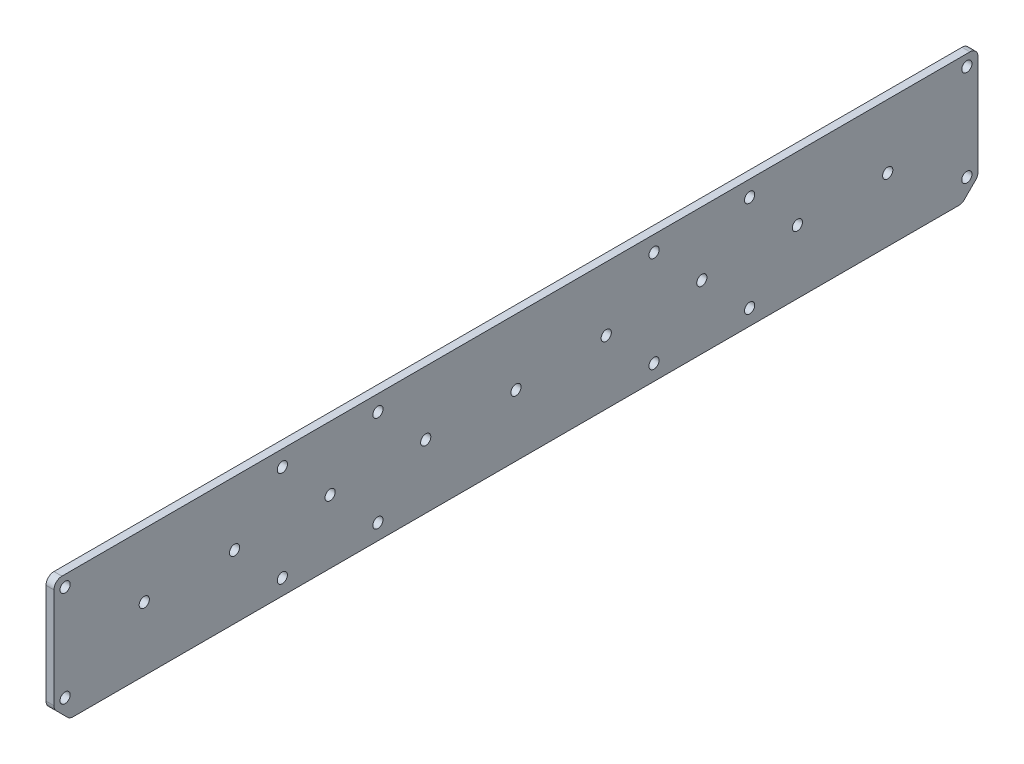
from build123d import *

# Parameters (mm, degrees)
SKETCH1_W                 = 368.3
SKETCH1_H                 = 50.8
BOSS_EXTRUDE1_DEPTH       = 3.175
CHAMFER1_SIZE             = 6.35
FILLET1_R                 = 3.175
F_8_0_16_DIAMETER_HOLE1_D = 4.064


with BuildPart() as part:
    # Sketch1 → Boss-Extrude1 (new body)
    with BuildSketch(Plane(origin=(0, 0, 0), x_dir=(0, 0, -1), z_dir=(1, 0, 0))):
        with Locations((184.15, 25.4)):
            Rectangle(SKETCH1_W, SKETCH1_H)
    extrude(amount=BOSS_EXTRUDE1_DEPTH)

    # Chamfer1
    chamfer1_edges = [part.edges().sort_by_distance(p)[0] for p in [
        (1.5875, 0, -368.3),
        (1.5875, 0, 0),
    ]]
    chamfer(chamfer1_edges, length=CHAMFER1_SIZE)

    # Fillet1
    fillet1_edges = [part.edges().sort_by_distance(p)[0] for p in [
        (1.5875, 0, -361.95),
        (1.5875, 6.35, -368.3),
        (1.5875, 50.8, -368.3),
        (1.5875, 0, -6.35),
        (1.5875, 6.35, 0),
        (1.5875, 50.8, 0),
    ]]
    fillet(fillet1_edges, radius=FILLET1_R)

    # #8 (0.16) Diameter Hole1 (through all)
    with Locations(Plane(origin=(3.175, 0, 0), x_dir=(0, 0, -1), z_dir=(1, 0, 0))):
        with Locations((91.025422327, 6.283968606), (91.025422327, 44.516031394), (71.975422327, 25.4), (35.992088994, 25.4), (148.175422327, 25.4), (129.125422327, 6.283968606), (110.075422327, 25.4), (129.125422327, 44.516031394), (184.15, 24.60625), (220.124577673, 25.4), (239.174577673, 6.283968606), (239.174577673, 44.516031394), (258.224577673, 25.4), (277.274577673, 6.283968606), (277.274577673, 44.516031394), (296.324577673, 25.4), (332.307911006, 25.4), (363.855, 46.355), (4.445, 46.355), (4.445, 8.191179285), (363.855, 8.191179285)):
            Hole(F_8_0_16_DIAMETER_HOLE1_D / 2)


solid = part.part
